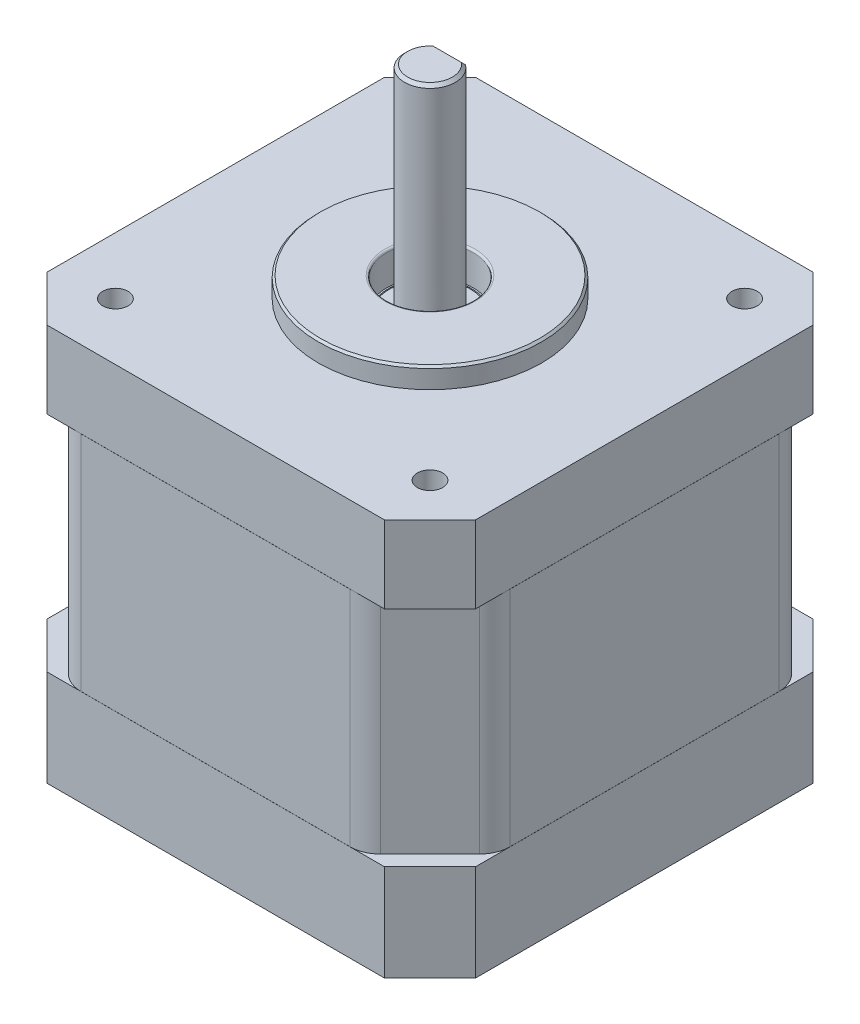
from build123d import *

# Parameters (mm, degrees)
CROQUIS1_R                      = 1
SALIENTE_EXTRUIR1_DEPTH         = 7.6
CROQUIS2_R                      = 11
SALIENTE_EXTRUIR2_DEPTH         = 2
CHAFL_N1_SIZE                   = 0.2
CROQUIS3_R                      = 4.25
CORTAR_EXTRUIR1_DEPTH           = 3.2
REDONDEO1_R                     = 0.2
CROQUIS4_R                      = 4.1
CROQUIS4_R_2                    = 4
CORTAR_EXTRUIR2_DEPTH           = 0.5
CROQUIS5_R                      = 2.5
SALIENTE_EXTRUIR3_DEPTH         = 21.2
CHAFL_N2_SIZE                   = 0.3
CORTAR_EXTRUIR4_START           = -17.2
CORTAR_EXTRUIR4_DEPTH           = 17.2
REDONDEO2_R                     = 0.1
CHAFL_N3_SIZE                   = 0.3
SALIENTE_EXTRUIR4_DEPTH         = 22
SALIENTE_EXTRUIR5_DEPTH         = 9.5
CROQUIS10_W                     = 16.35
CROQUIS10_H                     = 4
SALIENTE_EXTRUIR6_DEPTH         = 3.3
CORTAR_EXTRUIR5_START           = -0.5
CROQUIS11_R                     = 2.575
CROQUIS11_R_2                   = 2.5
CORTAR_EXTRUIR5_DEPTH           = 0.5
CROQUIS12_W                     = 14
CROQUIS12_H                     = 4.7
SALIENTE_EXTRUIR7_DEPTH         = 1
CROQUIS13_W                     = 15.2
CROQUIS13_H                     = 6.5
SALIENTE_EXTRUIR8_DEPTH         = 5.5
CORTAR_EXTRUIR6_DEPTH           = 4.1
CROQUIS15_W                     = 0.5
CROQUIS15_H                     = 0.5
SALIENTE_EXTRUIR9_DEPTH         = 3.5
CHAFL_N4_SIZE                   = 0.25
CROQUIS16_R                     = 3
CORTAR_EXTRUIR7_DEPTH           = 2.5
CROQUIS17_R                     = 2.75
SALIENTE_EXTRUIR10_DEPTH        = 2.3
REDONDEO3_R                     = 0.6
CORTAR_EXTRUIR8_DEPTH           = 1.1
CORTAR_EXTRUIR8_DRAFT           = -10
CORTAR_EXTRUIR8_PROFILE_2_DEPTH = 1.1
CORTAR_EXTRUIR8_PROFILE_2_DRAFT = -10
CORTAR_EXTRUIR8_PROFILE_3_DEPTH = 1.1
CORTAR_EXTRUIR8_PROFILE_3_DRAFT = -10
CORTAR_EXTRUIR8_PROFILE_4_DEPTH = 1.1
CORTAR_EXTRUIR8_PROFILE_4_DRAFT = -10
REDONDEO4_R                     = 0.2
CROQUIS19_R                     = 4.55
CORTAR_EXTRUIR9_DEPTH           = 3.7
CROQUIS20_R                     = 5.15
CORTAR_EXTRUIR10_DEPTH          = 2.5
REDONDEO5_R                     = 3
CORTAR_EXTRUIR_L_MINA1_DEPTH    = 0.01
CORTAR_EXTRUIR_L_MINA2_DEPTH    = 0.01
M3_TAPPED_HOLE1_D               = 2.5
M3_TAPPED_HOLE1_DEPTH           = 7.5
M3_TAPPED_HOLE1_TIP             = 0.751075774


with BuildPart() as part:
    # Croquis1 → Saliente-Extruir1 (new body)
    with BuildSketch(Plane(origin=(0, 0, 0), x_dir=(1, 0, 0), z_dir=(0, 1, 0))):
        Polygon((-21.125, 16.625), (-16.625, 21.125), (16.625, 21.125), (21.125, 16.625), (21.125, -16.625), (16.625, -21.125), (-16.625, -21.125), (-21.125, -16.625), align=None)
        with Locations(Location((-15.5, 15.5, 0), (0, 0, 90))):
            Circle(CROQUIS1_R, mode=Mode.SUBTRACT)
        with Locations(Location((15.5, 15.5, 0), (0, 0, 90))):
            Circle(CROQUIS1_R, mode=Mode.SUBTRACT)
        with Locations(Location((-15.5, -15.5, 0), (0, 0, 90))):
            Circle(CROQUIS1_R, mode=Mode.SUBTRACT)
        with Locations(Location((15.5, -15.5, 0), (0, 0, 90))):
            Circle(CROQUIS1_R, mode=Mode.SUBTRACT)
    extrude(amount=SALIENTE_EXTRUIR1_DEPTH)

    # Croquis2 → Saliente-Extruir2 (add)
    with BuildSketch(Plane(origin=(0, 7.6, 0), x_dir=(1, 0, 0), z_dir=(0, 1, 0))):
        with Locations(Location((0, 0, 0), (0, 0, 90))):
            Circle(CROQUIS2_R)
    extrude(amount=SALIENTE_EXTRUIR2_DEPTH)

    # Chaflán1
    chafl_n1_edges = [part.edges().sort_by_distance(p)[0] for p in [
        (0, 9.6, 11),
    ]]
    chamfer(chafl_n1_edges, length=CHAFL_N1_SIZE)

    # Croquis3 → Cortar-Extruir1 (cut)
    with BuildSketch(Plane(origin=(0, 9.6, 0), x_dir=(1, 0, 0), z_dir=(0, 1, 0))):
        with Locations(Location((0, 0, 0), (0, 0, 270))):
            Circle(CROQUIS3_R)
    extrude(amount=-CORTAR_EXTRUIR1_DEPTH, mode=Mode.SUBTRACT)

    # Redondeo1
    redondeo1_edges = [part.edges().sort_by_distance(p)[0] for p in [
        (0, 9.6, -4.25),
    ]]
    fillet(redondeo1_edges, radius=REDONDEO1_R)

    # Croquis4 → Cortar-Extruir2 (cut)
    with BuildSketch(Plane(origin=(0, 6.4, 0), x_dir=(1, 0, 0), z_dir=(0, 1, 0))):
        with Locations(Location((0, 0, 0), (0, 0, 270))):
            Circle(CROQUIS4_R)
        with Locations(Location((0, 0, 0), (0, 0, 270))):
            Circle(CROQUIS4_R_2, mode=Mode.SUBTRACT)
    extrude(amount=-CORTAR_EXTRUIR2_DEPTH, mode=Mode.SUBTRACT)

    # Croquis5 → Saliente-Extruir3 (add)
    with BuildSketch(Plane(origin=(0, 6.4, 0), x_dir=(1, 0, 0), z_dir=(0, 1, 0))):
        with Locations(Location((0, 0, 0), (0, 0, 270))):
            Circle(CROQUIS5_R)
    extrude(amount=SALIENTE_EXTRUIR3_DEPTH)

    # Chaflán2
    chafl_n2_edges = [part.edges().sort_by_distance(p)[0] for p in [
        (0, 27.6, -2.5),
    ]]
    chamfer(chafl_n2_edges, length=CHAFL_N2_SIZE)

    # Croquis7 → Cortar-Extruir4 (cut)
    with BuildSketch(Plane(origin=(0, 27.6, 0), x_dir=(1, 0, 0), z_dir=(0, 1, 0)).offset(CORTAR_EXTRUIR4_START)):
        with BuildLine():
            Line((-1.5, 2), (1.5, 2))
            ThreePointArc((1.5, 2), (0, 2.5), (-1.5, 2))
        make_face()
    extrude(amount=CORTAR_EXTRUIR4_DEPTH, mode=Mode.SUBTRACT)

    # Redondeo2
    redondeo2_edges = [part.edges().sort_by_distance(p)[0] for p in [
        (0, 10.4, -2),
    ]]
    fillet(redondeo2_edges, radius=REDONDEO2_R)

    # Chaflán3
    chafl_n3_edges = [part.edges().sort_by_distance(p)[0] for p in [
        (0, 27.6, -2),
    ]]
    chamfer(chafl_n3_edges, length=CHAFL_N3_SIZE)

    # Croquis8 → Saliente-Extruir4 (add)
    with BuildSketch(Plane.XZ):
        Polygon((-14.5, 21.125), (14.5, 21.125), (21.125, 14.5), (21.125, -14.5), (14.5, -21.125), (-14.5, -21.125), (-21.125, -14.5), (-21.125, 14.5), align=None)
    extrude(amount=SALIENTE_EXTRUIR4_DEPTH)

    # Croquis9 → Saliente-Extruir5 (add)
    with BuildSketch(Plane.XZ.offset(22)):
        Polygon((16.625, 21.125), (-16.625, 21.125), (-21.125, 16.625), (-21.125, -16.625), (-16.625, -21.125), (16.625, -21.125), (21.125, -16.625), (21.125, 16.625), align=None)
    extrude(amount=SALIENTE_EXTRUIR5_DEPTH)

    # Croquis10 → Saliente-Extruir6 (add)
    with BuildSketch(Plane.XZ.offset(31.5)):
        with Locations((0, -23.125)):
            Rectangle(CROQUIS10_W, CROQUIS10_H)
    extrude(amount=-SALIENTE_EXTRUIR6_DEPTH)

    # Croquis11 → Cortar-Extruir5 (cut)
    with BuildSketch(Plane(origin=(0, 6.4, 0), x_dir=(1, 0, 0), z_dir=(0, 1, 0)).offset(CORTAR_EXTRUIR5_START)):
        with Locations(Location((0, 0, 0), (0, 0, 270))):
            Circle(CROQUIS11_R)
        with Locations(Location((0, 0, 0), (0, 0, 57.140119621))):
            Circle(CROQUIS11_R_2, mode=Mode.SUBTRACT)
    extrude(amount=CORTAR_EXTRUIR5_DEPTH, mode=Mode.SUBTRACT)

    # Croquis12 → Saliente-Extruir7 (add)
    with BuildSketch(Plane(origin=(0, -28.2, 0), x_dir=(1, 0, 0), z_dir=(0, 1, 0))):
        with Locations((0, 23.475)):
            Rectangle(CROQUIS12_W, CROQUIS12_H)
    extrude(amount=SALIENTE_EXTRUIR7_DEPTH)

    # Croquis13 → Saliente-Extruir8 (add)
    with BuildSketch(Plane(origin=(0, -27.2, 0), x_dir=(1, 0, 0), z_dir=(0, 1, 0))):
        with Locations((0, 24.375)):
            Rectangle(CROQUIS13_W, CROQUIS13_H)
    extrude(amount=SALIENTE_EXTRUIR8_DEPTH)

    # Croquis14 → Cortar-Extruir6 (cut)
    with BuildSketch(Plane(origin=(0, 0, -27.625), x_dir=(-1, 0, 0), z_dir=(0, 0, -1))):
        Polygon((4, -22.7), (4, -21.7), (-4, -21.7), (-4, -22.7), (-6.6, -22.7), (-6.6, -26.2), (6.6, -26.2), (6.6, -22.7), align=None)
    extrude(amount=-CORTAR_EXTRUIR6_DEPTH, mode=Mode.SUBTRACT)

    # Croquis15 → Saliente-Extruir9 (add)
    with BuildSketch(Plane(origin=(0, 0, -23.525), x_dir=(-1, 0, 0), z_dir=(0, 0, -1))):
        with Locations((-2.82428572, -24.45)):
            Rectangle(CROQUIS15_W, CROQUIS15_H)
        with Locations((-4.71428572, -24.45)):
            Rectangle(CROQUIS15_W, CROQUIS15_H)
        with Locations((-0.93428572, -24.45)):
            Rectangle(CROQUIS15_W, CROQUIS15_H)
        with Locations((0.95571428, -24.45)):
            Rectangle(CROQUIS15_W, CROQUIS15_H)
        with Locations((2.84571428, -24.45)):
            Rectangle(CROQUIS15_W, CROQUIS15_H)
        with Locations((4.73571428, -24.45)):
            Rectangle(CROQUIS15_W, CROQUIS15_H)
    extrude(amount=SALIENTE_EXTRUIR9_DEPTH)

    # Chaflán4
    chafl_n4_edges = [part.edges().sort_by_distance(p)[0] for p in [
        (4.46428572, -24.45, -27.025),
        (4.71428572, -24.2, -27.025),
        (4.96428572, -24.45, -27.025),
        (4.71428572, -24.7, -27.025),
        (2.57428572, -24.45, -27.025),
        (2.82428572, -24.2, -27.025),
        (3.07428572, -24.45, -27.025),
        (2.82428572, -24.7, -27.025),
        (0.68428572, -24.45, -27.025),
        (0.93428572, -24.2, -27.025),
        (1.18428572, -24.45, -27.025),
        (0.93428572, -24.7, -27.025),
        (-1.20571428, -24.45, -27.025),
        (-0.95571428, -24.2, -27.025),
        (-0.70571428, -24.45, -27.025),
        (-0.95571428, -24.7, -27.025),
        (-3.09571428, -24.45, -27.025),
        (-2.84571428, -24.2, -27.025),
        (-2.59571428, -24.45, -27.025),
        (-2.84571428, -24.7, -27.025),
        (-4.98571428, -24.45, -27.025),
        (-4.73571428, -24.2, -27.025),
        (-4.48571428, -24.45, -27.025),
        (-4.73571428, -24.7, -27.025),
    ]]
    chamfer(chafl_n4_edges, length=CHAFL_N4_SIZE - 0.0001)  # a hair under: the kernel refuses the full size

    # Croquis16 → Cortar-Extruir7 (cut)
    with BuildSketch(Plane.XZ.offset(31.5)):
        with Locations(Location((-15.5, 15.5, 0), (0, 0, 270))):
            Circle(CROQUIS16_R)
        with Locations(Location((15.5, 15.5, 0), (0, 0, 270))):
            Circle(CROQUIS16_R)
        with Locations(Location((-15.5, -15.5, 0), (0, 0, 270))):
            Circle(CROQUIS16_R)
        with Locations(Location((15.5, -15.5, 0), (0, 0, 270))):
            Circle(CROQUIS16_R)
    extrude(amount=-CORTAR_EXTRUIR7_DEPTH, mode=Mode.SUBTRACT)

    # Croquis17 → Saliente-Extruir10 (add)
    with BuildSketch(Plane.XZ.offset(29)):
        with Locations(Location((15.5, 15.5, 0), (0, 0, 270))):
            Circle(CROQUIS17_R)
        with Locations(Location((-15.5, 15.5, 0), (0, 0, 270))):
            Circle(CROQUIS17_R)
        with Locations(Location((15.5, -15.5, 0), (0, 0, 270))):
            Circle(CROQUIS17_R)
        with Locations(Location((-15.5, -15.5, 0), (0, 0, 270))):
            Circle(CROQUIS17_R)
    extrude(amount=SALIENTE_EXTRUIR10_DEPTH)

    # Redondeo3
    redondeo3_edges = [part.edges().sort_by_distance(p)[0] for p in [
        (15.5, -31.3, 18.25),
        (-15.5, -31.3, 18.25),
        (15.5, -31.3, -12.75),
        (-15.5, -31.3, -12.75),
    ]]
    fillet(redondeo3_edges, radius=REDONDEO3_R)


with BuildPart() as cortar_extruir8_tool:
    # Croquis18 → Cortar-Extruir8 (with draft: the straight prism first)
    with BuildSketch(Plane.XZ.offset(31.3)):
        Polygon((17.303122292, 14.545405845), (16.348528137, 15.5), (17.303122292, 16.454594155), (16.454594155, 17.303122292), (15.5, 16.348528137), (14.545405845, 17.303122292), (13.696877708, 16.454594155), (14.651471863, 15.5), (13.696877708, 14.545405845), (14.545405845, 13.696877708), (15.5, 14.651471863), (16.454594155, 13.696877708), align=None)
    extrude(amount=-CORTAR_EXTRUIR8_DEPTH)
    # Cortar-Extruir8: the draft: its side faces are tilted about the plane it starts from
    cortar_extruir8_sides = [cortar_extruir8_tool.faces().sort_by_distance(p)[0] for p in [
        (16.825825215, -30.75, 15.022702923),
        (16.825825215, -30.75, 15.977297077),
        (16.878858223, -30.75, 16.878858223),
        (15.977297077, -30.75, 16.825825215),
        (15.022702923, -30.75, 16.825825215),
        (14.121141777, -30.75, 16.878858223),
        (14.174174785, -30.75, 15.977297077),
        (14.174174785, -30.75, 15.022702923),
        (14.121141777, -30.75, 14.121141777),
        (15.022702923, -30.75, 14.174174785),
        (15.977297077, -30.75, 14.174174785),
        (16.878858223, -30.75, 14.121141777),
    ]]
    draft(cortar_extruir8_sides, Plane.XZ.offset(31.3), CORTAR_EXTRUIR8_DRAFT)


with BuildPart() as part_1:
    add(part.part)

    # Cortar-Extruir8: cut by cortar_extruir8_tool
    add(cortar_extruir8_tool.part, mode=Mode.SUBTRACT)


with BuildPart() as cortar_extruir8_profile_2_tool:
    # Croquis18 → Cortar-Extruir8 profile 2 (with draft: the straight prism first)
    with BuildSketch(Plane.XZ.offset(31.3)):
        Polygon((-17.303122292, 16.454594155), (-16.348528137, 15.5), (-17.303122292, 14.545405845), (-16.454594155, 13.696877708), (-15.5, 14.651471863), (-14.545405845, 13.696877708), (-13.696877708, 14.545405845), (-14.651471863, 15.5), (-13.696877708, 16.454594155), (-14.545405845, 17.303122292), (-15.5, 16.348528137), (-16.454594155, 17.303122292), align=None)
    extrude(amount=-CORTAR_EXTRUIR8_PROFILE_2_DEPTH)
    # Cortar-Extruir8 profile 2: the draft: its side faces are tilted about the plane it starts from
    cortar_extruir8_profile_2_sides = [cortar_extruir8_profile_2_tool.faces().sort_by_distance(p)[0] for p in [
        (-16.825825215, -30.75, 15.977297077),
        (-16.825825215, -30.75, 15.022702923),
        (-16.878858223, -30.75, 14.121141777),
        (-15.977297077, -30.75, 14.174174785),
        (-15.022702923, -30.75, 14.174174785),
        (-14.121141777, -30.75, 14.121141777),
        (-14.174174785, -30.75, 15.022702923),
        (-14.174174785, -30.75, 15.977297077),
        (-14.121141777, -30.75, 16.878858223),
        (-15.022702923, -30.75, 16.825825215),
        (-15.977297077, -30.75, 16.825825215),
        (-16.878858223, -30.75, 16.878858223),
    ]]
    draft(cortar_extruir8_profile_2_sides, Plane.XZ.offset(31.3), CORTAR_EXTRUIR8_PROFILE_2_DRAFT)


with BuildPart() as part_2:
    add(part_1.part)

    # Cortar-Extruir8 profile 2: cut by cortar_extruir8_profile_2_tool
    add(cortar_extruir8_profile_2_tool.part, mode=Mode.SUBTRACT)


with BuildPart() as cortar_extruir8_profile_3_tool:
    # Croquis18 → Cortar-Extruir8 profile 3 (with draft: the straight prism first)
    with BuildSketch(Plane.XZ.offset(31.3)):
        Polygon((-13.696877708, -16.454594155), (-14.651471863, -15.5), (-13.696877708, -14.545405845), (-14.545405845, -13.696877708), (-15.5, -14.651471863), (-16.454594155, -13.696877708), (-17.303122292, -14.545405845), (-16.348528137, -15.5), (-17.303122292, -16.454594155), (-16.454594155, -17.303122292), (-15.5, -16.348528137), (-14.545405845, -17.303122292), align=None)
    extrude(amount=-CORTAR_EXTRUIR8_PROFILE_3_DEPTH)
    # Cortar-Extruir8 profile 3: the draft: its side faces are tilted about the plane it starts from
    cortar_extruir8_profile_3_sides = [cortar_extruir8_profile_3_tool.faces().sort_by_distance(p)[0] for p in [
        (-14.174174785, -30.75, -15.977297077),
        (-14.174174785, -30.75, -15.022702923),
        (-14.121141777, -30.75, -14.121141777),
        (-15.022702923, -30.75, -14.174174785),
        (-15.977297077, -30.75, -14.174174785),
        (-16.878858223, -30.75, -14.121141777),
        (-16.825825215, -30.75, -15.022702923),
        (-16.825825215, -30.75, -15.977297077),
        (-16.878858223, -30.75, -16.878858223),
        (-15.977297077, -30.75, -16.825825215),
        (-15.022702923, -30.75, -16.825825215),
        (-14.121141777, -30.75, -16.878858223),
    ]]
    draft(cortar_extruir8_profile_3_sides, Plane.XZ.offset(31.3), CORTAR_EXTRUIR8_PROFILE_3_DRAFT)


with BuildPart() as part_3:
    add(part_2.part)

    # Cortar-Extruir8 profile 3: cut by cortar_extruir8_profile_3_tool
    add(cortar_extruir8_profile_3_tool.part, mode=Mode.SUBTRACT)


with BuildPart() as cortar_extruir8_profile_4_tool:
    # Croquis18 → Cortar-Extruir8 profile 4 (with draft: the straight prism first)
    with BuildSketch(Plane.XZ.offset(31.3)):
        Polygon((16.348528137, -15.5), (17.303122292, -14.545405845), (16.454594155, -13.696877708), (15.5, -14.651471863), (14.545405845, -13.696877708), (13.696877708, -14.545405845), (14.651471863, -15.5), (13.696877708, -16.454594155), (14.545405845, -17.303122292), (15.5, -16.348528137), (16.454594155, -17.303122292), (17.303122292, -16.454594155), align=None)
    extrude(amount=-CORTAR_EXTRUIR8_PROFILE_4_DEPTH)
    # Cortar-Extruir8 profile 4: the draft: its side faces are tilted about the plane it starts from
    cortar_extruir8_profile_4_sides = [cortar_extruir8_profile_4_tool.faces().sort_by_distance(p)[0] for p in [
        (16.825825215, -30.75, -15.022702923),
        (16.878858223, -30.75, -14.121141777),
        (15.977297077, -30.75, -14.174174785),
        (15.022702923, -30.75, -14.174174785),
        (14.121141777, -30.75, -14.121141777),
        (14.174174785, -30.75, -15.022702923),
        (14.174174785, -30.75, -15.977297077),
        (14.121141777, -30.75, -16.878858223),
        (15.022702923, -30.75, -16.825825215),
        (15.977297077, -30.75, -16.825825215),
        (16.878858223, -30.75, -16.878858223),
        (16.825825215, -30.75, -15.977297077),
    ]]
    draft(cortar_extruir8_profile_4_sides, Plane.XZ.offset(31.3), CORTAR_EXTRUIR8_PROFILE_4_DRAFT)


with BuildPart() as part_4:
    add(part_3.part)

    # Cortar-Extruir8 profile 4: cut by cortar_extruir8_profile_4_tool
    add(cortar_extruir8_profile_4_tool.part, mode=Mode.SUBTRACT)

    # Redondeo4
    redondeo4_edges = [part_4.edges().sort_by_distance(p)[0] for p in [
        (17.165972088, -30.75, 14.545405845),
        (16.454594155, -30.75, 13.834027912),
        (15.5, -30.75, 14.788622067),
        (14.545405845, -30.75, 13.834027912),
        (13.834027912, -30.75, 14.545405845),
        (14.788622067, -30.75, 15.5),
        (13.834027912, -30.75, 16.454594155),
        (14.545405845, -30.75, 17.165972088),
        (15.5, -30.75, 16.211377933),
        (16.454594155, -30.75, 17.165972088),
        (17.165972088, -30.75, 16.454594155),
        (16.211377933, -30.75, 15.5),
        (-14.788622067, -30.75, 15.5),
        (-13.834027912, -30.75, 14.545405845),
        (-14.545405845, -30.75, 13.834027912),
        (-15.5, -30.75, 14.788622067),
        (-16.454594155, -30.75, 13.834027912),
        (-17.165972088, -30.75, 14.545405845),
        (-16.211377933, -30.75, 15.5),
        (-17.165972088, -30.75, 16.454594155),
        (-16.454594155, -30.75, 17.165972088),
        (-15.5, -30.75, 16.211377933),
        (-14.545405845, -30.75, 17.165972088),
        (-13.834027912, -30.75, 16.454594155),
        (-13.834027912, -30.75, -16.454594155),
        (-14.545405845, -30.75, -17.165972088),
        (-15.5, -30.75, -16.211377933),
        (-16.454594155, -30.75, -17.165972088),
        (-17.165972088, -30.75, -16.454594155),
        (-16.211377933, -30.75, -15.5),
        (-17.165972088, -30.75, -14.545405845),
        (-16.454594155, -30.75, -13.834027912),
        (-15.5, -30.75, -14.788622067),
        (-14.545405845, -30.75, -13.834027912),
        (-13.834027912, -30.75, -14.545405845),
        (-14.788622067, -30.75, -15.5),
        (16.211377933, -30.75, -15.5),
        (17.165972088, -30.75, -16.454594155),
        (16.454594155, -30.75, -17.165972088),
        (15.5, -30.75, -16.211377933),
        (14.545405845, -30.75, -17.165972088),
        (13.834027912, -30.75, -16.454594155),
        (14.788622067, -30.75, -15.5),
        (13.834027912, -30.75, -14.545405845),
        (14.545405845, -30.75, -13.834027912),
        (15.5, -30.75, -14.788622067),
        (16.454594155, -30.75, -13.834027912),
        (17.165972088, -30.75, -14.545405845),
    ]]
    fillet(redondeo4_edges, radius=REDONDEO4_R)

    # Croquis19 → Cortar-Extruir9 (cut)
    with BuildSketch(Plane.XZ.offset(31.5)):
        with Locations(Location((0, 0, 0), (0, 0, 270))):
            Circle(CROQUIS19_R)
    extrude(amount=-CORTAR_EXTRUIR9_DEPTH, mode=Mode.SUBTRACT)

    # Croquis20 → Cortar-Extruir10 (cut)
    with BuildSketch(Plane.XZ.offset(27.8)):
        with Locations(Location((0, 0, 0), (0, 0, 270))):
            Circle(CROQUIS20_R)
    extrude(amount=CORTAR_EXTRUIR10_DEPTH, mode=Mode.SUBTRACT)

    # Redondeo5
    redondeo5_edges = [part_4.edges().sort_by_distance(p)[0] for p in [
        (-21.125, -11, -14.5),
        (-14.5, -11, -21.125),
        (-21.125, -11, 14.5),
        (-14.5, -11, 21.125),
        (14.5, -11, 21.125),
        (21.125, -11, 14.5),
        (14.5, -11, -21.125),
        (21.125, -11, -14.5),
    ]]
    fillet(redondeo5_edges, radius=REDONDEO5_R)

    # Croquis24 → Cortar-Extruir-Lámina1 (cut)
    with BuildSketch(Plane(origin=(0, -22, 0), x_dir=(1, 0, 0), z_dir=(0, 1, 0))):
        Polygon((-21.125, 14.5), (-21.125, -14.5), (-14.5, -21.125), (14.5, -21.125), (21.125, -14.5), (21.125, 14.5), (14.5, 21.125), (-14.5, 21.125), align=None)
        Polygon((-19.125, 13.671572875), (-19.125, -13.671572875), (-13.671572875, -19.125), (13.671572875, -19.125), (19.125, -13.671572875), (19.125, 13.671572875), (13.671572875, 19.125), (-13.671572875, 19.125), align=None, mode=Mode.SUBTRACT)
    extrude(amount=CORTAR_EXTRUIR_L_MINA1_DEPTH, mode=Mode.SUBTRACT)

    # Croquis25 → Cortar-Extruir-Lámina2 (cut)
    with BuildSketch(Plane.XZ):
        Polygon((21.125, -14.5), (21.125, 14.5), (14.5, 21.125), (-14.5, 21.125), (-21.125, 14.5), (-21.125, -14.5), (-14.5, -21.125), (14.5, -21.125), align=None)
        Polygon((19.125, -13.671572875), (19.125, 13.671572875), (13.671572875, 19.125), (-13.671572875, 19.125), (-19.125, 13.671572875), (-19.125, -13.671572875), (-13.671572875, -19.125), (13.671572875, -19.125), align=None, mode=Mode.SUBTRACT)
    extrude(amount=CORTAR_EXTRUIR_L_MINA2_DEPTH, mode=Mode.SUBTRACT)

    # M3 Tapped Hole1
    with Locations(Plane(origin=(0, 7.6, 0), x_dir=(1, 0, 0), z_dir=(0, 1, 0))):
        with Locations((-15.5, 15.5), (15.5, 15.5), (15.5, -15.5), (-15.5, -15.5)):
            Hole(M3_TAPPED_HOLE1_D / 2, depth=M3_TAPPED_HOLE1_DEPTH)
            with Locations((0, 0, -(M3_TAPPED_HOLE1_DEPTH + M3_TAPPED_HOLE1_TIP / 2))):  # 118° drill point
                Cone(0, M3_TAPPED_HOLE1_D / 2, M3_TAPPED_HOLE1_TIP, mode=Mode.SUBTRACT)


solid = part_4.part
